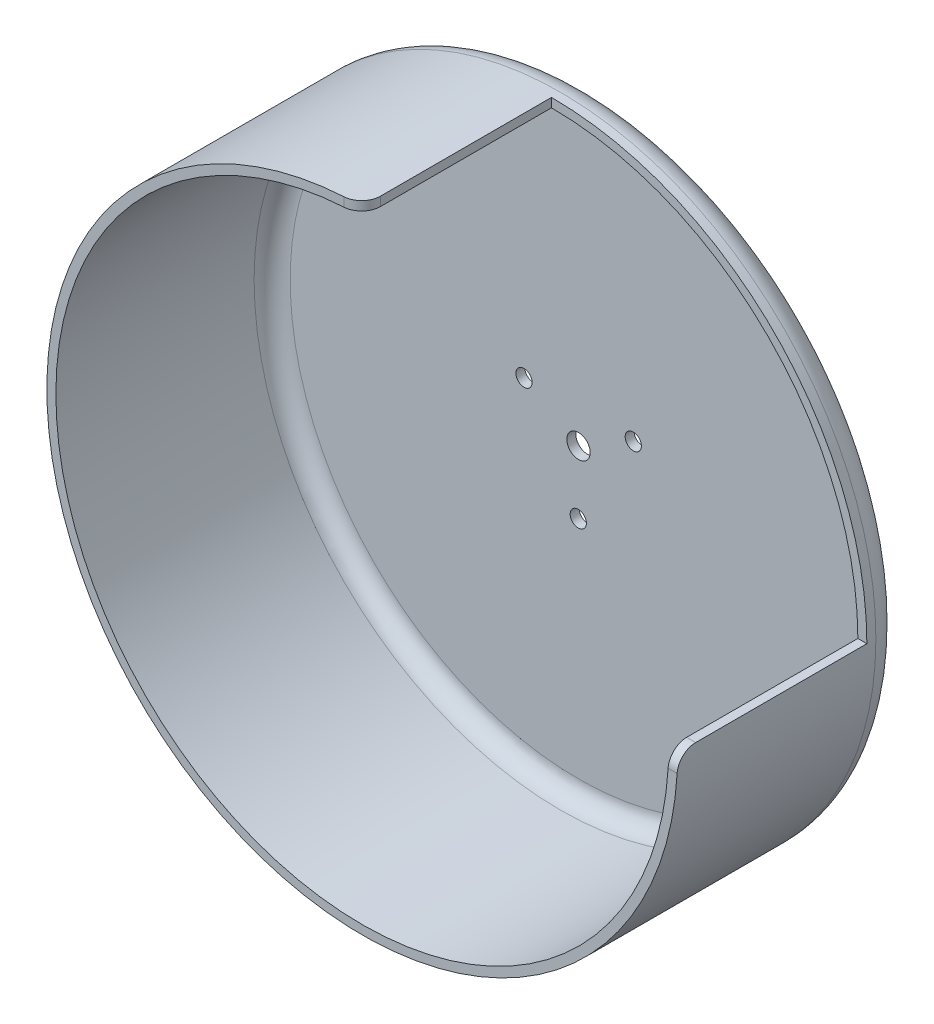
from build123d import *

# Parameters (mm, degrees)
SKETCH_1_R               = 175
EXTRUDE_1_DEPTH          = 125
SHELL_3_T                = -5
SKETCH_2_W               = 5
SKETCH_2_H               = 105
CUT_REVOLVE_1_ANGLE      = 90
FILLET_1_R               = 10
FILLET_2_R               = 15
SKETCH_3_R               = 6.5
CUT_EXTRUDE_1_DEPTH      = 125
FILLET_3_R               = 10
FILLET_START             = 169
FILLET_4_DEPTH           = 7
SKETCH_5_R               = 4.5
CUT_EXTRUDE_2_DEPTH      = 125
PATTERN_CIRCULAR_1_COUNT = 3


with BuildPart() as part:
    # 草图1 → 凸台-拉伸1 (new body)
    with BuildSketch(Plane.XY):
        Circle(SKETCH_1_R)
    extrude(amount=EXTRUDE_1_DEPTH)

    # 抽壳3
    shell_3_openings = [part.faces().sort_by_distance(p)[0] for p in [
        (0, 0, 125),
    ]]
    offset(amount=SHELL_3_T, openings=shell_3_openings, kind=Kind.INTERSECTION)

    # 草图2 → 切除-旋转1 (revolve, cut)
    with BuildSketch(Plane(origin=(0, 0, 0), x_dir=(1, 0, 0), z_dir=(0, 1, 0))):
        with Locations((172.5, -72.5)):
            Rectangle(SKETCH_2_W, SKETCH_2_H)
    revolve(axis=Axis((0, 0, 0), (0, 0, 1)), revolution_arc=CUT_REVOLVE_1_ANGLE, mode=Mode.SUBTRACT)

    # 圆角1
    fillet_1_edges = [part.edges().sort_by_distance(p)[0] for p in [
        (-170, 0, 5),
    ]]
    fillet(fillet_1_edges, radius=FILLET_1_R)

    # 圆角2
    fillet_2_edges = [part.edges().sort_by_distance(p)[0] for p in [
        (-175, 0, 0),
    ]]
    fillet(fillet_2_edges, radius=FILLET_2_R)

    # 草图3 → 切除-拉伸1 (cut)
    with BuildSketch(Plane.XY.offset(5)):
        Circle(SKETCH_3_R)
    extrude(amount=-CUT_EXTRUDE_1_DEPTH, mode=Mode.SUBTRACT)

    # 圆角3
    fillet_3_edges = [part.edges().sort_by_distance(p)[0] for p in [
        (0, 172.5, 125),
    ]]
    fillet(fillet_3_edges, radius=FILLET_3_R)

    # 圆角4: read off the stored shape, not the designer's step
    # 圆角4 outline → 圆角4 (cut)
    with BuildSketch(Plane.YZ.offset(FILLET_START)):
        with BuildLine():
            ThreePointArc((-10, 125), (-2.928932188, 122.071067812), (0, 115))
            Line((0, 115), (0, 125))
            Line((0, 125), (-10, 125))
        make_face()
    extrude(amount=FILLET_4_DEPTH, mode=Mode.SUBTRACT)

    # 草图5 → 切除-拉伸2 (cut)
    with BuildSketch(Plane.XY.offset(5)):
        with Locations((-30.243552325, 17.616115995)):
            Circle(SKETCH_5_R)
    cut_extrude_2 = extrude(amount=-CUT_EXTRUDE_2_DEPTH, mode=Mode.SUBTRACT)

    # 阵列(圆周)1: 切除-拉伸2 ×3 about axis
    pattern_circular_1_axis = Axis((0, 0, 0), (0, 0, 1))
    for i in range(1, PATTERN_CIRCULAR_1_COUNT):
        add(cut_extrude_2.rotate(pattern_circular_1_axis, i * 360 / PATTERN_CIRCULAR_1_COUNT), mode=Mode.SUBTRACT)


solid = part.part
